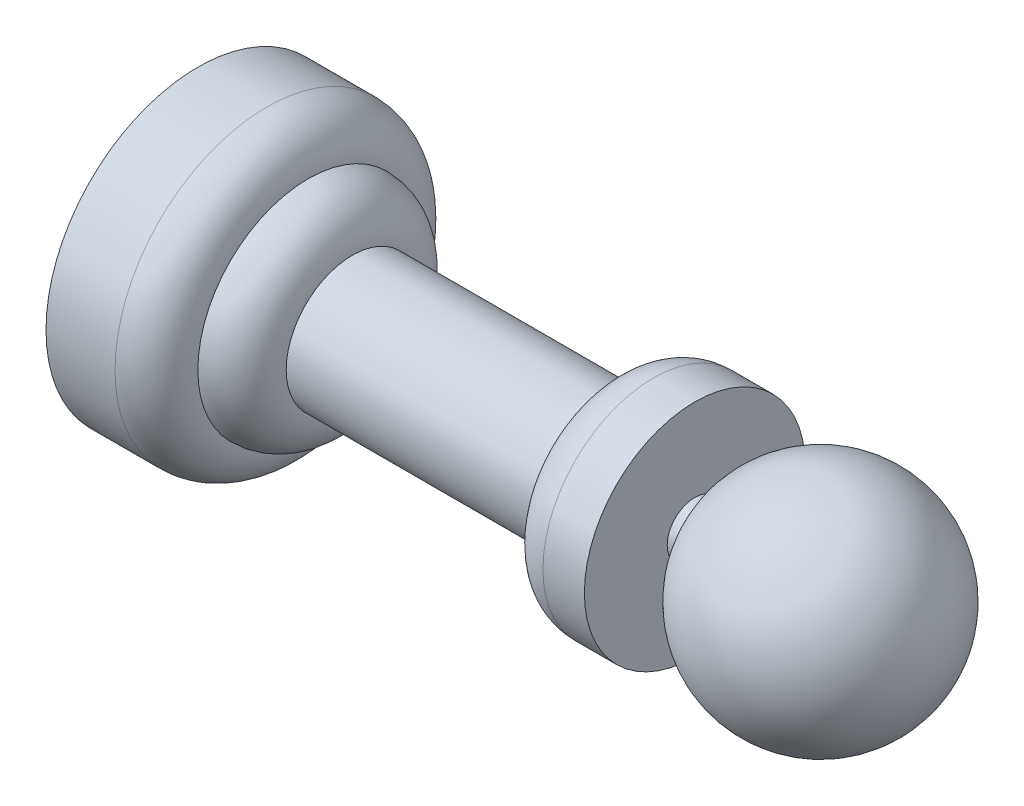
from build123d import *

# Parameters (mm, degrees)
SKETCH_3_R          = 10
CUT_EXTRUDE_1_DEPTH = 2.5


with BuildPart() as part:
    # Эскиз2 → Повернуть7 (revolve)
    with BuildSketch(Plane.XY):
        with BuildLine():
            Line((0, 11), (0, 0))
            Line((0, 0), (5, 0))
            ThreePointArc((5, 0), (7.121320344, 0.878679656), (8, 3))
            ThreePointArc((8, 3), (10.2627417, 3.9372583), (11.2, 6.2))
            Line((11.2, 6.2), (29.8, 6.2))
            ThreePointArc((29.8, 6.2), (30.7372583, 3.9372583), (33, 3))
            Line((33, 3), (36, 3))
            Line((36, 3), (36, 9))
            Line((36, 9), (37.270805384, 9))
            ThreePointArc((37.270805384, 9), (46.105803041, 2.98451199), (53.176533665, 11))
            Line((53.176533665, 11), (0, 11))
        make_face()
    revolve(axis=Axis((0, 11, 0), (1, 0, 0)))

    # Эскиз3 → Вырез-Вытянуть1 (cut)
    with BuildSketch(Plane.ZY):
        with Locations((0, 11)):
            Circle(SKETCH_3_R)
    extrude(amount=-CUT_EXTRUDE_1_DEPTH, mode=Mode.SUBTRACT)


solid = part.part
